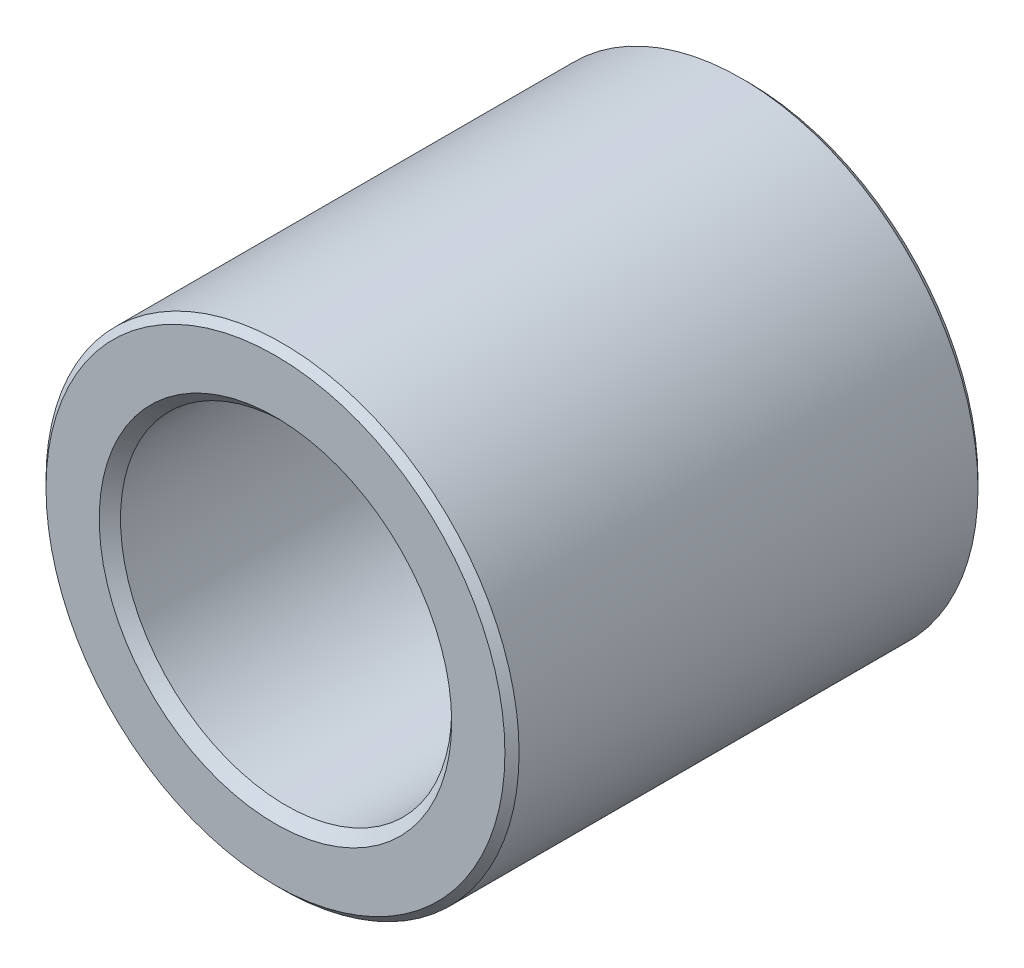
from build123d import *

# Parameters (mm, degrees)
BOSS_EXTRUDE1_DEPTH      = 3
BOSS_EXTRUDE1_DEPTH_BACK = 3
SKETCH3_R                = 3
SKETCH3_R_2              = 2.1
CHAMFER1_SIZE            = 0.09
CHAMFER2_SIZE            = 0.135


with BuildPart() as part:
    # Sketch3 → Boss-Extrude1 (new, two sides: drawn at the far end of the back side and taken through both)
    with BuildSketch(Plane.XY.offset(-BOSS_EXTRUDE1_DEPTH_BACK)):
        Circle(SKETCH3_R)
        Circle(SKETCH3_R_2, mode=Mode.SUBTRACT)
    extrude(amount=BOSS_EXTRUDE1_DEPTH + BOSS_EXTRUDE1_DEPTH_BACK)

    # Chamfer1
    chamfer1_edges = [part.edges().sort_by_distance(p)[0] for p in [
        (-3, 0, -3),
        (-3, 0, 3),
    ]]
    chamfer(chamfer1_edges, length=CHAMFER1_SIZE)

    # Chamfer2
    chamfer2_edges = [part.edges().sort_by_distance(p)[0] for p in [
        (-2.1, 0, -3),
        (-2.1, 0, 3),
    ]]
    chamfer(chamfer2_edges, length=CHAMFER2_SIZE)


solid = part.part
